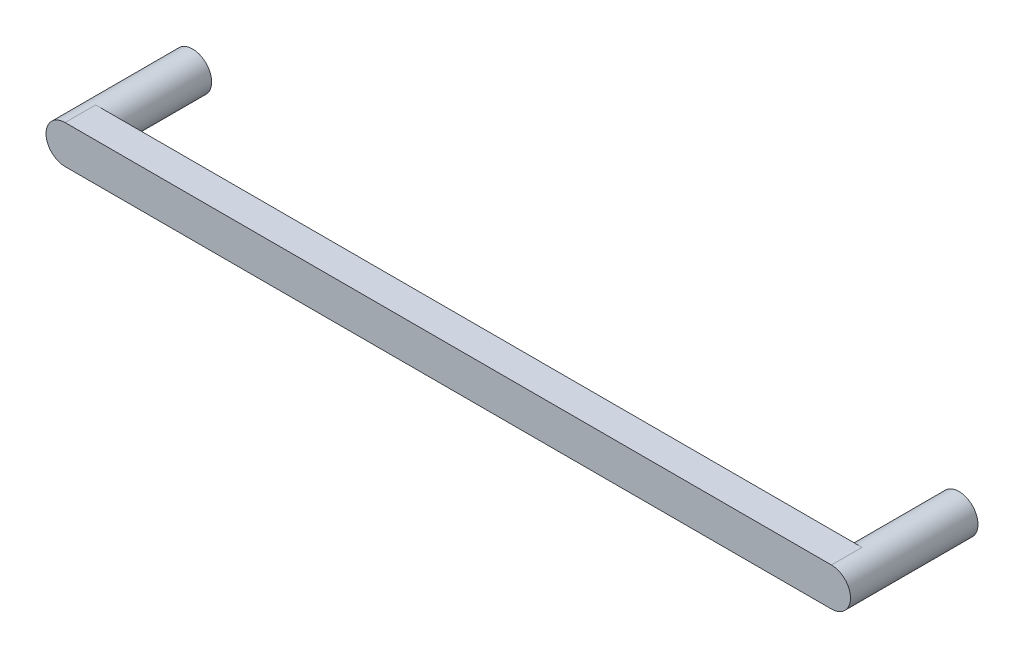
from build123d import *

# Parameters (mm, degrees)
BOSS_EXTRUDE1_DEPTH = 4
BOSS_EXTRUDE2_START = -12.7
SKETCH1_3_R         = 2.5
BOSS_EXTRUDE2_DEPTH = 12.7


with BuildPart() as part:
    # Sketch1 → Boss-Extrude1 (new body)
    with BuildSketch(Plane.XY):
        with BuildLine():
            ThreePointArc((-102.9, 5), (-105.4, 2.5), (-102.9, 0))
            Line((-102.9, 0), (-2.500000007, 0))
            ThreePointArc((-2.500000007, 0), (0, 2.499999997), (-2.5, 5))
            Line((-2.5, 5), (-102.9, 5))
        make_face()
    extrude(amount=BOSS_EXTRUDE1_DEPTH)

    # Sketch1<3> → Boss-Extrude2 (add)
    with BuildSketch(Plane.XY.offset(BOSS_EXTRUDE2_START)):
        with Locations((-2.5, 2.5)):
            Circle(SKETCH1_3_R)
        with Locations((-102.9, 2.5)):
            Circle(SKETCH1_3_R)
    extrude(amount=BOSS_EXTRUDE2_DEPTH)


solid = part.part
